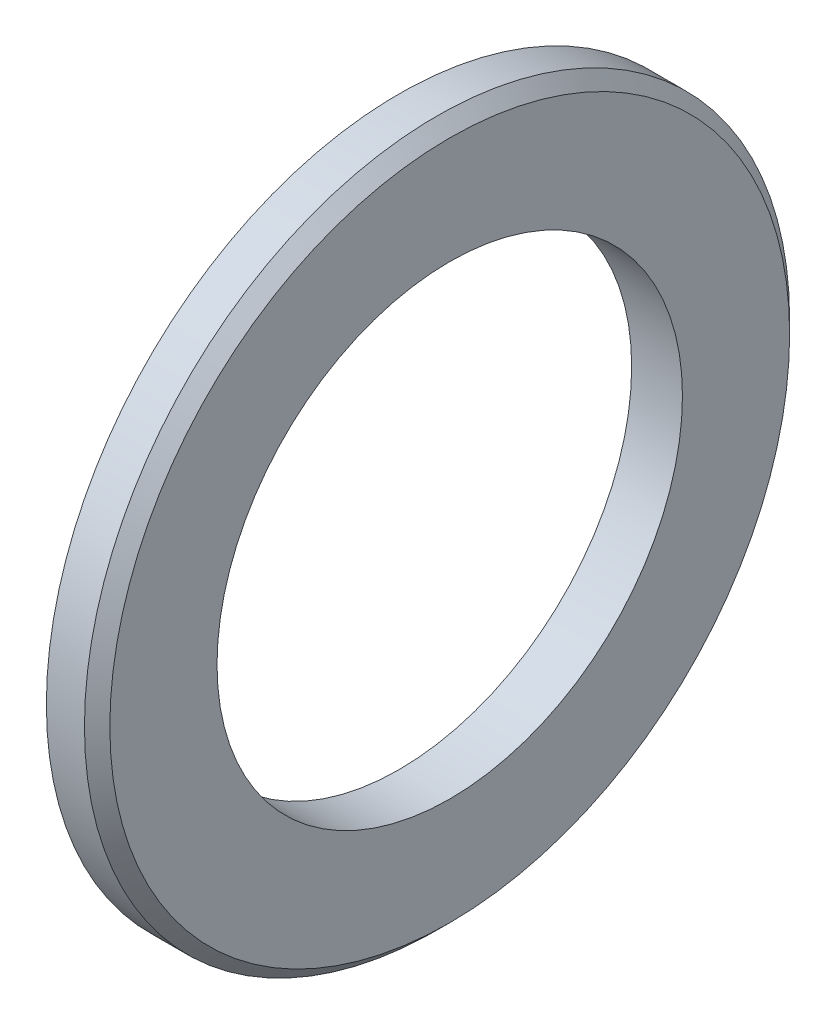
from build123d import *

# Parameters (mm, degrees)
SKETCH1_W      = 18
SKETCH1_H      = 42.5
ODCHAMFER_SIZE = 4.5


with BuildPart() as part:
    # Sketch1 → Base-Revolve (revolve)
    with BuildSketch(Plane.XY):
        with Locations((-9, 103.75)):
            Rectangle(SKETCH1_W, SKETCH1_H)
    revolve(axis=Axis((-34.925, 0, 0), (1, 0, 0)))

    # ODChamfer
    odchamfer_edges = [part.edges().sort_by_distance(p)[0] for p in [
        (0, -125, 0),
    ]]
    chamfer(odchamfer_edges, length=ODCHAMFER_SIZE)


solid = part.part
